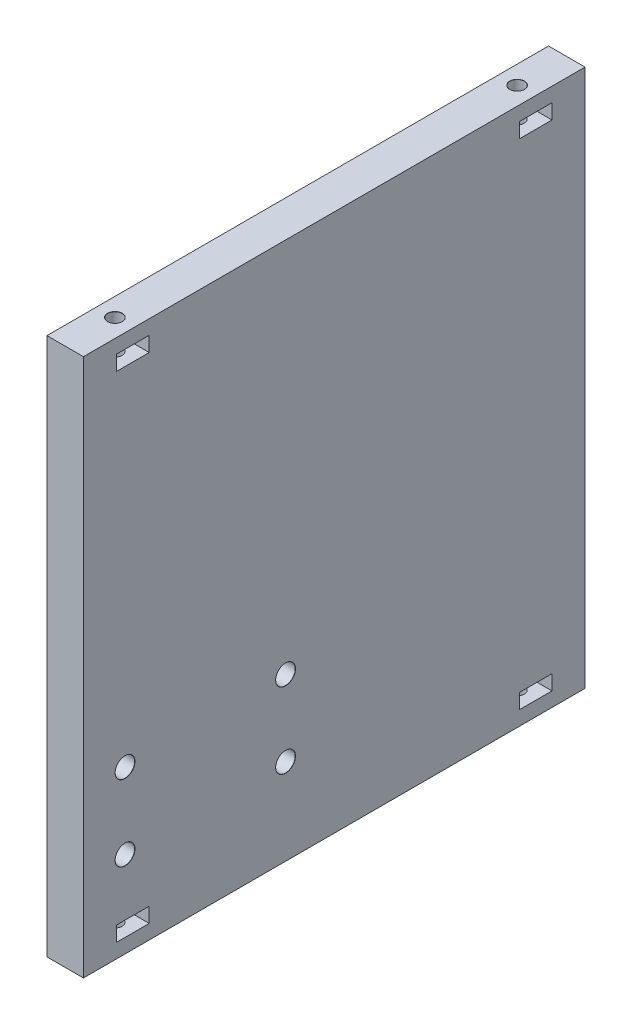
from build123d import *

# Parameters (mm, degrees)
SKETCH1_W                             = 87.3
SKETCH1_H                             = 93.65
BOSS_EXTRUDE1_DEPTH                   = 6.35
TAP_DRILL_FOR_M3X0_5_TAP1_D           = 2.5
TAP_DRILL_FOR_M3X0_5_TAP1_DEPTH       = 10
TAP_DRILL_FOR_M3X0_5_TAP1_CSINK_D     = 2.55
TAP_DRILL_FOR_M3X0_5_TAP1_CSINK_ANGLE = 90
TAP_DRILL_FOR_M3X0_5_TAP1_TIP         = 0.751075774
TAP_DRILL_FOR_M3X0_5_TAP2_D           = 2.5
TAP_DRILL_FOR_M3X0_5_TAP2_DEPTH       = 9.248924226
TAP_DRILL_FOR_M3X0_5_TAP2_CSINK_D     = 2.55
TAP_DRILL_FOR_M3X0_5_TAP2_CSINK_ANGLE = 90
TAP_DRILL_FOR_M3X0_5_TAP2_TIP         = 0.751075774
M3_CLEARANCE_HOLE1_D                  = 3.4
M3_CLEARANCE_HOLE1_CSINK_D            = 3.45
M3_CLEARANCE_HOLE1_CSINK_ANGLE        = 90
SKETCH11_W                            = 5.7
SKETCH11_H                            = 2.6
CUT_EXTRUDE3_DEPTH                    = 69.796098182


with BuildPart() as part:
    # Sketch1 → Boss-Extrude1 (new body)
    with BuildSketch(Plane(origin=(0, 0, 0), x_dir=(0, 0, -1), z_dir=(1, 0, 0))):
        Rectangle(SKETCH1_W, SKETCH1_H)
    extrude(amount=BOSS_EXTRUDE1_DEPTH)

    # Tap Drill for M3x0.5 Tap1
    with Locations(Plane(origin=(0, 46.825, 0), x_dir=(1, 0, 0), z_dir=(0, 1, 0))):
        with Locations((3.175, 35), (3.175, -35)):
            CounterSinkHole(TAP_DRILL_FOR_M3X0_5_TAP1_D / 2, TAP_DRILL_FOR_M3X0_5_TAP1_CSINK_D / 2, depth=TAP_DRILL_FOR_M3X0_5_TAP1_DEPTH, counter_sink_angle=TAP_DRILL_FOR_M3X0_5_TAP1_CSINK_ANGLE)
            with Locations((0, 0, -(TAP_DRILL_FOR_M3X0_5_TAP1_DEPTH + TAP_DRILL_FOR_M3X0_5_TAP1_TIP / 2))):  # 118° drill point
                Cone(0, TAP_DRILL_FOR_M3X0_5_TAP1_D / 2, TAP_DRILL_FOR_M3X0_5_TAP1_TIP, mode=Mode.SUBTRACT)

    # Tap Drill for M3x0.5 Tap2
    with Locations(Plane(origin=(0, -46.825, 0), x_dir=(-1, 0, 0), z_dir=(0, -1, 0))):
        with Locations((-3.175, -35), (-3.175, 35)):
            CounterSinkHole(TAP_DRILL_FOR_M3X0_5_TAP2_D / 2, TAP_DRILL_FOR_M3X0_5_TAP2_CSINK_D / 2, depth=TAP_DRILL_FOR_M3X0_5_TAP2_DEPTH, counter_sink_angle=TAP_DRILL_FOR_M3X0_5_TAP2_CSINK_ANGLE)
            with Locations((0, 0, -(TAP_DRILL_FOR_M3X0_5_TAP2_DEPTH + TAP_DRILL_FOR_M3X0_5_TAP2_TIP / 2))):  # 118° drill point
                Cone(0, TAP_DRILL_FOR_M3X0_5_TAP2_D / 2, TAP_DRILL_FOR_M3X0_5_TAP2_TIP, mode=Mode.SUBTRACT)

    # M3 Clearance Hole1 (through all)
    with Locations(Plane(origin=(6.35, 0, 0), x_dir=(0, 0, -1), z_dir=(1, 0, 0))):
        with Locations((-36.41, -18.655), (-8.47, -18.655), (-8.47, -31.825), (-36.41, -31.825)):
            CounterSinkHole(M3_CLEARANCE_HOLE1_D / 2, M3_CLEARANCE_HOLE1_CSINK_D / 2, counter_sink_angle=M3_CLEARANCE_HOLE1_CSINK_ANGLE)

    # Sketch11 → Cut-Extrude3 (cut, through all)
    with BuildSketch(Plane(origin=(6.35, 0, -6.35), x_dir=(0, 0, 1), z_dir=(-1, 0, 0))):
        with Locations((41.4, -43.025)):
            Rectangle(SKETCH11_W, SKETCH11_H)
        with Locations((-28.7, -43.025)):
            Rectangle(SKETCH11_W, SKETCH11_H)
        with Locations((-28.7, 43.025)):
            Rectangle(SKETCH11_W, SKETCH11_H)
        with Locations((41.4, 43.025)):
            Rectangle(SKETCH11_W, SKETCH11_H)
    extrude(amount=CUT_EXTRUDE3_DEPTH, mode=Mode.SUBTRACT)


solid = part.part
